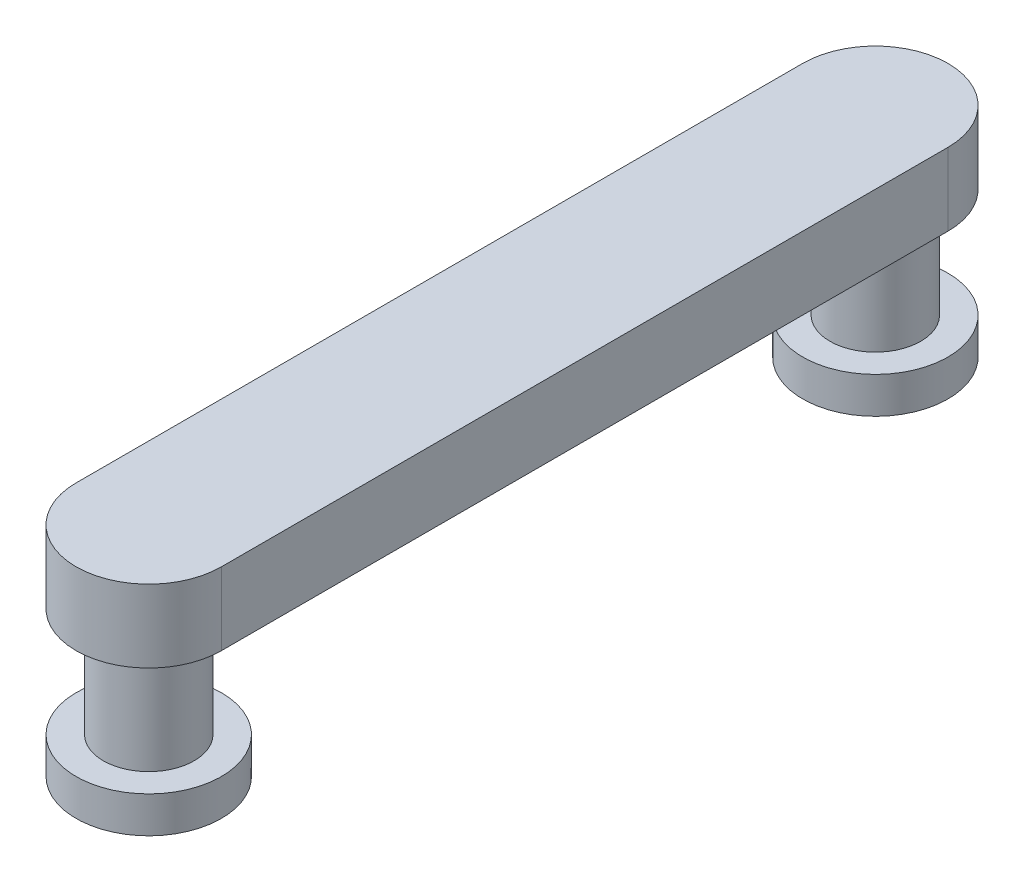
from build123d import *

# Parameters (mm, degrees)
BOSS_EXTRUDE1_DEPTH = 5.08
SKETCH3_R           = 3.175
BOSS_EXTRUDE2_DEPTH = 7.62
BOSS_EXTRUDE3_START = 2.54
SKETCH6_R           = 5.08
BOSS_EXTRUDE3_DEPTH = 2.54
BOSS_EXTRUDE4_START = 2.54
SKETCH8_R           = 5.08
BOSS_EXTRUDE4_DEPTH = 2.54


with BuildPart() as part:
    # Sketch2 → Boss-Extrude1 (new body)
    with BuildSketch(Plane(origin=(0, 0, 0), x_dir=(1, 0, 0), z_dir=(0, 1, 0))):
        with BuildLine():
            Line((-5.08, 25.4), (-5.08, -25.4))
            ThreePointArc((-5.08, -25.4), (0, -30.48), (5.08, -25.4))
            Line((5.08, -25.4), (5.08, 25.4))
            ThreePointArc((5.08, 25.4), (0, 30.48), (-5.08, 25.4))
        make_face()
    extrude(amount=BOSS_EXTRUDE1_DEPTH)

    # Sketch3 → Boss-Extrude2 (add)
    with BuildSketch(Plane(origin=(0, 0, 0), x_dir=(-1, 0, 0), z_dir=(0, -1, 0))):
        with Locations((0, -25.4)):
            Circle(SKETCH3_R)
        with Locations((0, 25.4)):
            Circle(SKETCH3_R)
    extrude(amount=BOSS_EXTRUDE2_DEPTH)

    # Sketch6 → Boss-Extrude3 (add)
    with BuildSketch(Plane.XZ.offset(7.62).offset(BOSS_EXTRUDE3_START)):
        with Locations((0, 25.4)):
            Circle(SKETCH6_R)
    extrude(amount=-BOSS_EXTRUDE3_DEPTH)

    # Sketch8 → Boss-Extrude4 (add)
    with BuildSketch(Plane.XZ.offset(7.62).offset(BOSS_EXTRUDE4_START)):
        with Locations((0, -25.4)):
            Circle(SKETCH8_R)
    extrude(amount=-BOSS_EXTRUDE4_DEPTH)


solid = part.part
